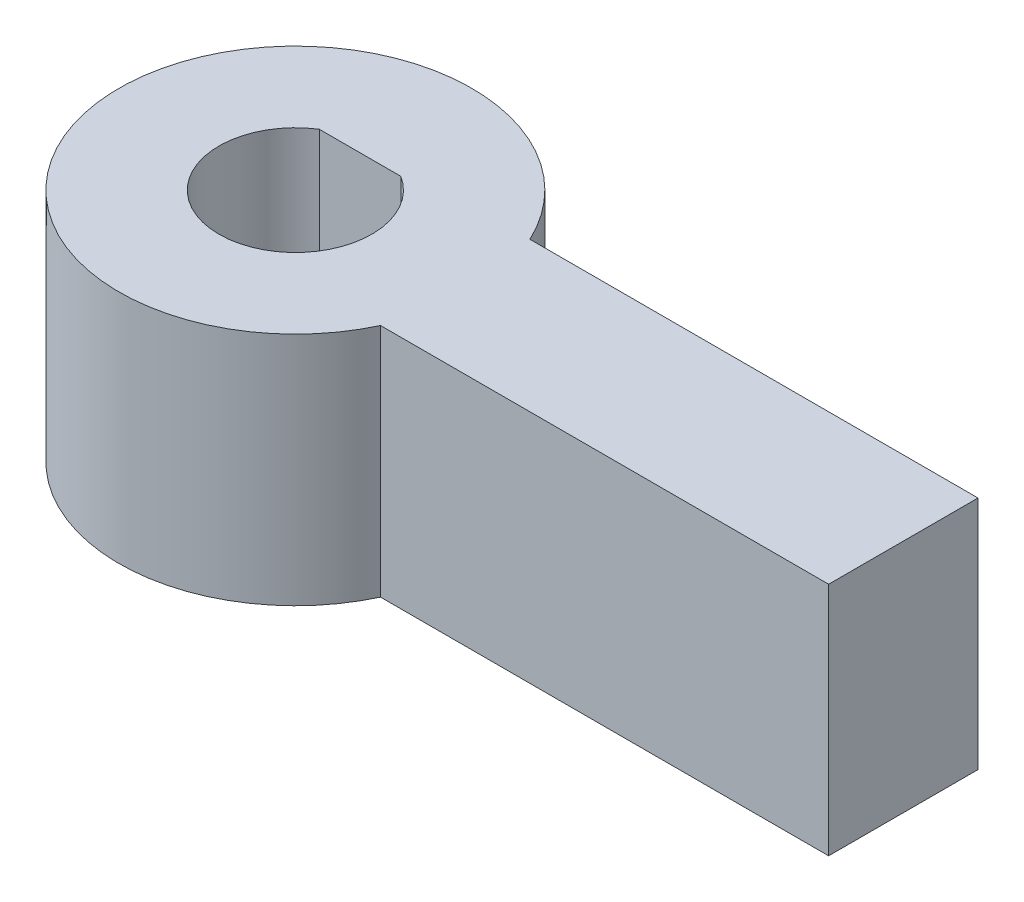
from build123d import *

# Parameters (mm, degrees)
BOSS_EXTRUDE1_DEPTH = 10


with BuildPart() as part:
    # Sketch1 → Boss-Extrude1 (new body)
    with BuildSketch(Plane(origin=(0, 0, 0), x_dir=(1, 0, 0), z_dir=(0, 1, 0))):
        with BuildLine():
            Line((6.794805001, 3.175), (25.844805001, 3.175))
            Line((25.844805001, 3.175), (25.844805001, -3.175))
            Line((25.844805001, -3.175), (6.794805001, -3.175))
            ThreePointArc((6.794805001, -3.175), (-7.5, 0), (6.794805001, 3.175))
        make_face()
        with BuildLine():
            Line((1.732050808, 2.75), (-1.732050808, 2.75))
            ThreePointArc((-1.732050808, 2.75), (0, -3.25), (1.732050808, 2.75))
        make_face(mode=Mode.SUBTRACT)
    extrude(amount=BOSS_EXTRUDE1_DEPTH)


solid = part.part
